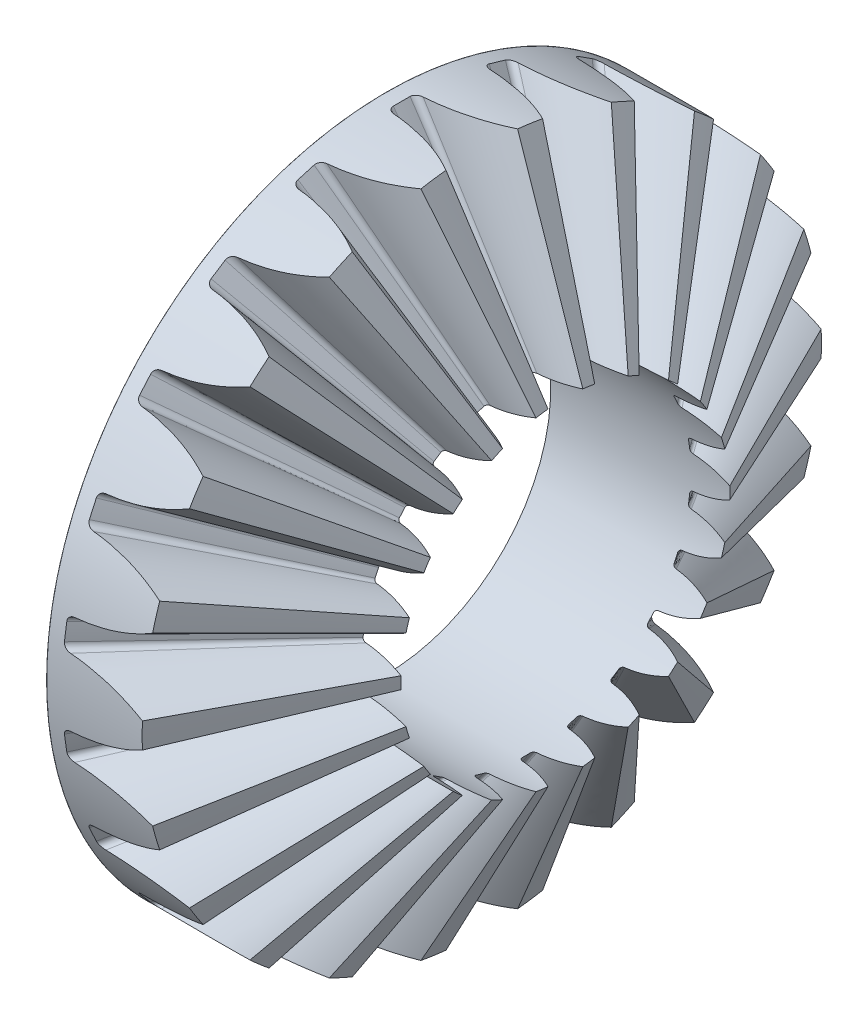
from build123d import *

# Parameters (mm, degrees)
TEETHCUTS_COUNT         = 22
TEETHCUTS_ANGLE         = 343.636363636
HUBSKE_R                = 11.35682087
HUB_DEPTH               = 0.0001016
BORSKE_R                = 0.5
BORE_DEPTH              = 8.616712539
CUT_EXTRUDE1_DEPTH      = 10
CUT_EXTRUDE1_DEPTH_BACK = 10
SKETCH1_R               = 5.5
CUT_EXTRUDE3_DEPTH      = 10
CUT_EXTRUDE3_DEPTH_BACK = 10
SKETCH2_R               = 15.072732184
SKETCH2_R_2             = 11.357


with BuildPart() as part:
    # BasProSke → Base-Revolve (revolve)
    with BuildSketch(Plane(origin=(0, 0, 0), x_dir=(1, 0, 0), z_dir=(0, 1, 0)), mode=Mode.PRIVATE) as base_revolve_sk:
        Polygon((0, 0), (0, 11.356820872), (2.535150198, 12.739630067), (8.008510572, 1.273962999), (7.754995553, 1.13568208), (7.754995553, 0), align=None)
    revolve(base_revolve_sk.sketch.rotate(Axis((-10, 0, 0), (1, 0, 0)), 180), axis=Axis((-10, 0, 0), (1, 0, 0)))

    # ToothCut: read off the stored shape, not the designer's step
    # ToothCut: loft between two sections, ruled curve by curve
    toothcut_from = [
        Edge.make_bspline([(8.624992782, 0.004544205, -0.008440001), (8.619679308, 0.001645946, -0.015245351), (8.611705745, -0.00270327, -0.014572795), (8.607330193, -0.005089935, -0.006950191)], [0, 0, 0, 0, 1, 1, 1, 1], 3, [1, 0.738381325, 0.738381325, 1]),
        Edge.make_bspline([(8.607330193, -0.005089935, 0.006950191), (8.611705745, -0.00270327, 0.014572795), (8.619679308, 0.001645946, 0.015245351), (8.624992782, 0.004544205, 0.008440001)], [0, 0, 0, 0, 1, 1, 1, 1], 3, [1, 0.738381325, 0.738381325, 1]),
        Edge.make_bspline([(8.607330193, -0.005089935, -0.006950191), (8.606740359, -0.005411662, -0.005922648), (8.606286568, -0.005659184, -0.004809066), (8.60597828, -0.005827342, -0.003632657)], [0, 0, 0, 0, 1, 1, 1, 1], 3, [1, 0.993052087, 0.993052087, 1]),
        Edge.make_bspline([(8.60597828, -0.005827342, 0.003632657), (8.606286568, -0.005659184, 0.004809066), (8.606740359, -0.005411662, 0.005922648), (8.607330193, -0.005089935, 0.006950191)], [0, 0, 0, 0, 1, 1, 1, 1], 3, [1, 0.993052087, 0.993052087, 1]),
        Edge.make_bspline([(8.60597828, -0.005827342, -0.003632657), (8.605352726, -0.006168553, -0.00124558), (8.605352726, -0.006168553, 0.00124558), (8.60597828, -0.005827342, 0.003632657)], [0, 0, 0, 0, 1, 1, 1, 1], 3, [1, 0.972145921, 0.972145921, 1]),
        Edge.make_line((8.624992782, 0.004544205, 0.008440001), (8.624992782, 0.004544205, -0.008440001)),
    ]
    toothcut_to = [
        Edge.make_bspline([(2.69167098, 12.825005039, -1.501893761), (2.062101326, 12.48160341, -0.947934063), (1.325257641, 12.079688674, -0.606349658), (0.535010748, 11.648644916, -0.502113864)], [0, 0, 0, 0, 1, 1, 1, 1], 3, [1, 0.975629919, 0.975629919, 1]),
        Edge.make_bspline([(0.535010748, 11.648644916, 0.502113864), (1.325257641, 12.079688674, 0.606349658), (2.062101326, 12.48160341, 0.947934063), (2.69167098, 12.825005039, 1.501893761)], [0, 0, 0, 0, 1, 1, 1, 1], 3, [1, 0.975629919, 0.975629919, 1]),
        Edge.make_bspline([(0.535010748, 11.648644916, -0.502113864), (0.433929614, 11.593509752, -0.488780977), (0.36726323, 11.55714627, -0.401211929), (0.369983456, 11.558630029, -0.285343699)], [0, 0, 0, 0, 1, 1, 1, 1], 3, [1, 0.825139964, 0.825139964, 1]),
        Edge.make_bspline([(0.369983456, 11.558630029, 0.285343699), (0.36726323, 11.55714627, 0.401211929), (0.433929614, 11.593509752, 0.488780977), (0.535010748, 11.648644916, 0.502113864)], [0, 0, 0, 0, 1, 1, 1, 1], 3, [1, 0.825139964, 0.825139964, 1]),
        Edge.make_bspline([(0.369983456, 11.558630029, -0.285343699), (0.374448911, 11.561065732, -0.095137233), (0.374448911, 11.561065732, 0.095137233), (0.369983456, 11.558630029, 0.285343699)], [0, 0, 0, 0, 1, 1, 1, 1], 3, [1, 0.999761745, 0.999761745, 1]),
        Edge.make_line((2.69167098, 12.825005039, 1.501893761), (2.69167098, 12.825005039, -1.501893761)),
    ]
    toothcut = Solid(Shell([*[Face.make_surface_from_curves(toothcut_from[k], toothcut_to[k]) for k in range(6)], Face(Wire(toothcut_from)), Face(Wire(toothcut_to))]))
    add(toothcut, mode=Mode.SUBTRACT)

    # TeethCuts: ToothCut ×22 about axis
    teethcuts_axis = Axis((-10, 0, 0), (1, 0, 0))
    for i in range(1, TEETHCUTS_COUNT):
        add(toothcut.rotate(teethcuts_axis, i * TEETHCUTS_ANGLE / (TEETHCUTS_COUNT - 1)), mode=Mode.SUBTRACT)

    # HubSke → Hub (add)
    with BuildSketch(Plane.ZY):
        Circle(HUBSKE_R)
    extrude(amount=HUB_DEPTH)

    # BorSke → Bore (cut, symmetric)
    with BuildSketch(Plane(origin=(0, 0, 0), x_dir=(0, 0, -1), z_dir=(1, 0, 0))):
        with Locations(Location((0, 0, 0), (0, 0, 180))):
            Circle(BORSKE_R)
    extrude(amount=BORE_DEPTH, both=True, mode=Mode.SUBTRACT)

    # Sketch1 → Cut-Extrude1 (cut, two sides: drawn at the far end of the back side and taken through both)
    with BuildSketch(Plane(origin=(0, 0, 0), x_dir=(0, 0, -1), z_dir=(1, 0, 0)).offset(-CUT_EXTRUDE1_DEPTH_BACK)):
        with Locations(Location((0, 0, 0), (0, 0, 180))):
            Circle(SKETCH1_R)
    extrude(amount=CUT_EXTRUDE1_DEPTH + CUT_EXTRUDE1_DEPTH_BACK, mode=Mode.SUBTRACT)

    # Sketch2 → Cut-Extrude3 (cut, two sides: drawn at the far end of the back side and taken through both)
    with BuildSketch(Plane(origin=(0, 0, 0), x_dir=(0, 0, -1), z_dir=(1, 0, 0)).offset(-CUT_EXTRUDE3_DEPTH_BACK)):
        Circle(SKETCH2_R)
        with Locations(Location((0, 0, 0), (0, 0, 182.128109348))):
            Circle(SKETCH2_R_2, mode=Mode.SUBTRACT)
    extrude(amount=CUT_EXTRUDE3_DEPTH + CUT_EXTRUDE3_DEPTH_BACK, mode=Mode.SUBTRACT)


solid = part.part
